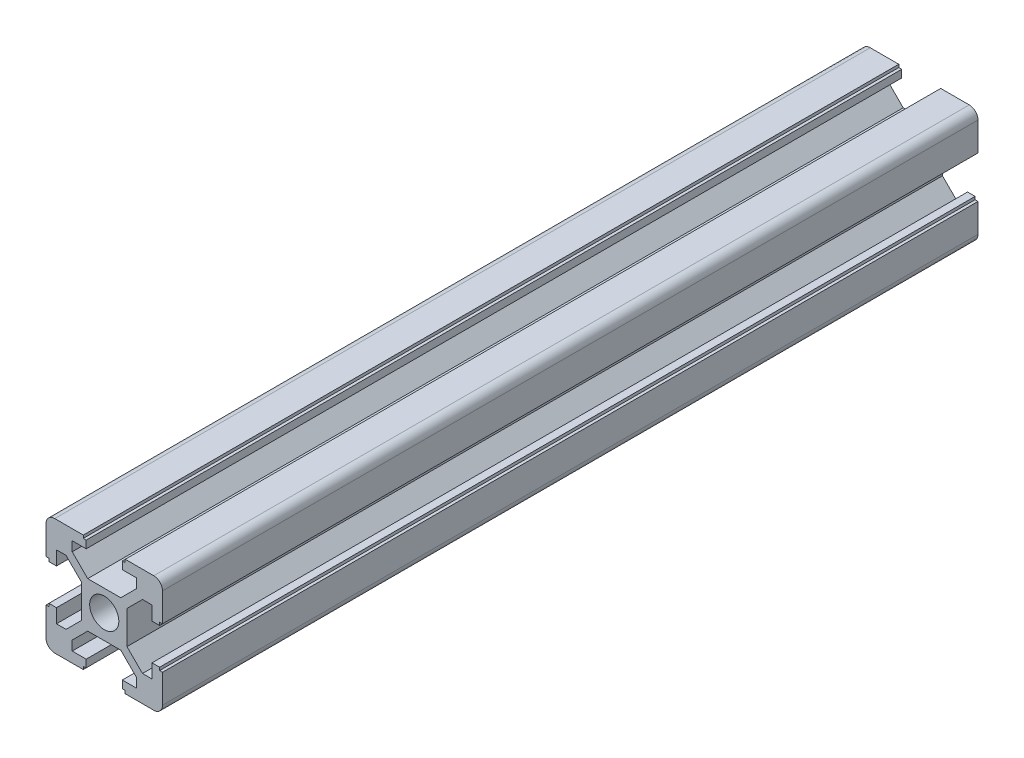
from build123d import *

# Parameters (mm, degrees)
SKETCH1_R           = 2.5
BOSS_EXTRUDE1_DEPTH = 140
SCALE_2_SCALE       = 3
SCALE_3_SCALE       = 6
SCALE_5_SCALE       = 2
SCALE_6_SCALE       = 0.25
SCALE_7_SCALE       = 0.125
SCALE_8_SCALE       = 0.25
SCALE_9_SCALE       = 4
SCALE_10_SCALE      = 4
OTHER_START         = -17.55
OTHER_1_OUTLINE_R   = 5
OTHER_1_DEPTH       = 10


# Read off the part's stored shape, not the designer's step: 孔1
with BuildPart() as part:
    # Sketch1 → Boss-Extrude1 (new body)
    with BuildSketch(Plane.XY):
        with BuildLine():
            Line((2.839339828, 3.9), (5.5, 6.560660172))
            Line((5.5, 6.560660172), (5.5, 8.2))
            Line((5.5, 8.2), (3.1, 8.2))
            Line((3.1, 8.2), (3.1, 9.5))
            Line((3.1, 9.5), (3.6, 9.5))
            Line((3.6, 9.5), (3.6, 10))
            Line((3.6, 10), (8.5, 10))
            ThreePointArc((8.5, 10), (9.560660172, 9.560660172), (10, 8.5))
            Line((10, 8.5), (10, 3.6))
            Line((10, 3.6), (9.5, 3.6))
            Line((9.5, 3.6), (9.5, 3.1))
            Line((9.5, 3.1), (8.2, 3.1))
            Line((8.2, 3.1), (8.2, 5.5))
            Line((8.2, 5.5), (6.560660172, 5.5))
            Line((6.560660172, 5.5), (3.9, 2.839339828))
            Line((3.9, 2.839339828), (3.9, -2.839339828))
            Line((3.9, -2.839339828), (6.560660172, -5.5))
            Line((6.560660172, -5.5), (8.2, -5.5))
            Line((8.2, -5.5), (8.2, -3.1))
            Line((8.2, -3.1), (9.5, -3.1))
            Line((9.5, -3.1), (9.5, -3.6))
            Line((9.5, -3.6), (10, -3.6))
            Line((10, -3.6), (10, -8.5))
            ThreePointArc((10, -8.5), (9.560660172, -9.560660172), (8.5, -10))
            Line((8.5, -10), (3.6, -10))
            Line((3.6, -10), (3.6, -9.5))
            Line((3.6, -9.5), (3.1, -9.5))
            Line((3.1, -9.5), (3.1, -8.2))
            Line((3.1, -8.2), (5.5, -8.2))
            Line((5.5, -8.2), (5.5, -6.560660172))
            Line((5.5, -6.560660172), (2.839339828, -3.9))
            Line((2.839339828, -3.9), (-2.839339828, -3.9))
            Line((-2.839339828, -3.9), (-5.5, -6.560660172))
            Line((-5.5, -6.560660172), (-5.5, -8.2))
            Line((-5.5, -8.2), (-3.1, -8.2))
            Line((-3.1, -8.2), (-3.1, -9.5))
            Line((-3.1, -9.5), (-3.6, -9.5))
            Line((-3.6, -9.5), (-3.6, -10))
            Line((-3.6, -10), (-8.5, -10))
            ThreePointArc((-8.5, -10), (-9.560660172, -9.560660172), (-10, -8.5))
            Line((-10, -8.5), (-10, -3.6))
            Line((-10, -3.6), (-9.5, -3.6))
            Line((-9.5, -3.6), (-9.5, -3.1))
            Line((-9.5, -3.1), (-8.2, -3.1))
            Line((-8.2, -3.1), (-8.2, -5.5))
            Line((-8.2, -5.5), (-6.560660172, -5.5))
            Line((-6.560660172, -5.5), (-3.9, -2.839339828))
            Line((-3.9, -2.839339828), (-3.9, 2.839339828))
            Line((-3.9, 2.839339828), (-6.560660172, 5.5))
            Line((-6.560660172, 5.5), (-8.2, 5.5))
            Line((-8.2, 5.5), (-8.2, 3.1))
            Line((-8.2, 3.1), (-9.5, 3.1))
            Line((-9.5, 3.1), (-9.5, 3.6))
            Line((-9.5, 3.6), (-10, 3.6))
            Line((-10, 3.6), (-10, 8.5))
            ThreePointArc((-10, 8.5), (-9.560660172, 9.560660172), (-8.5, 10))
            Line((-8.5, 10), (-3.6, 10))
            Line((-3.6, 10), (-3.6, 9.5))
            Line((-3.6, 9.5), (-3.1, 9.5))
            Line((-3.1, 9.5), (-3.1, 8.2))
            Line((-3.1, 8.2), (-5.5, 8.2))
            Line((-5.5, 8.2), (-5.5, 6.560660172))
            Line((-5.5, 6.560660172), (-2.839339828, 3.9))
            Line((-2.839339828, 3.9), (2.839339828, 3.9))
        make_face()
        with Locations((0, 0.235847297)):
            Circle(SKETCH1_R, mode=Mode.SUBTRACT)
    extrude(amount=BOSS_EXTRUDE1_DEPTH)


with BuildPart() as part_1:
    # 缩放比例2: scaled about (0, -0.027095247, 70)
    add(part.part.scale(SCALE_2_SCALE).moved(Location((0, 0.054190494, -140))))


with BuildPart() as part_2:
    # 缩放比例3: scaled about (0, -0.027095247, 70)
    add(part_1.part.scale(SCALE_3_SCALE).moved(Location((0, 0.135476235, -350))))


with BuildPart() as part_3:
    # 缩放比例5: scaled about (0, -0.027095249, 70)
    add(part_2.part.scale(SCALE_5_SCALE).moved(Location((0, 0.027095249, -70))))


with BuildPart() as part_4:
    # 缩放比例6: scaled about (0, -0.027095249, 70)
    add(part_3.part.scale(SCALE_6_SCALE).moved(Location((0, -0.020321437, 52.5))))


with BuildPart() as part_5:
    # 缩放比例7: scaled about (0, -0.027095249, 70)
    add(part_4.part.scale(SCALE_7_SCALE).moved(Location((0, -0.023708343, 61.25))))


with BuildPart() as part_6:
    # 缩放比例8: scaled about (0, -0.027095249, 70)
    add(part_5.part.scale(SCALE_8_SCALE).moved(Location((0, -0.020321437, 52.5))))


with BuildPart() as part_7:
    # 缩放比例9: scaled about (0, -0.027095249, 70)
    add(part_6.part.scale(SCALE_9_SCALE).moved(Location((0, 0.081285747, -210))))


with BuildPart() as part_8:
    # 缩放比例10: scaled about (0, -0.027095249, 70)
    add(part_7.part.scale(SCALE_10_SCALE).moved(Location((0, 0.081285747, -210))))

    # 孔1 outline → 孔1 (cut)
    with BuildSketch(Plane.YZ.offset(OTHER_START)):
        with Locations((7.344833538, 1.297306883)):
            Circle(OTHER_1_OUTLINE_R)
    extrude(amount=OTHER_1_DEPTH, mode=Mode.SUBTRACT)


solid = part_8.part
